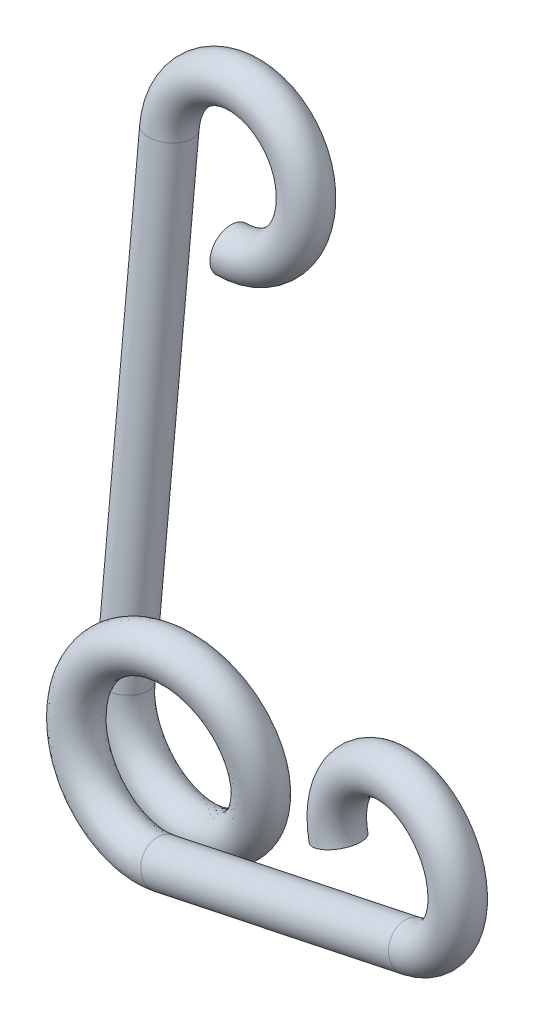
from build123d import *

# Parameters (mm, degrees)
SWEEP1_PITCH        = 1.779213779
SWEEP1_HEIGHT       = 2.304
SWEEP1_RADIUS       = 2.925
SWEEP1_START_ANGLE  = -180
SWEEP1_PROFILE_R    = 0.772
SKETCH7_R           = 0.772
BOSS_EXTRUDE1_DEPTH = 16.8
SKETCH8_R           = 0.772
BOSS_EXTRUDE2_DEPTH = 10.57
SKETCH11_R          = 0.772
SKETCH13_R          = 0.772


with BuildPart() as part:
    # Sweep1: sweep along a helix
    with BuildLine() as sweep1_path:
        add(Helix(SWEEP1_PITCH, SWEEP1_HEIGHT, SWEEP1_RADIUS, center=(0, 0, 0), direction=(0, 0, 1), mode=Mode.PRIVATE).rotate(Axis((0, 0, 0), (0, 0, 1)), SWEEP1_START_ANGLE))
    # Sweep1 profile (on start of the path) → Sweep1 (sweep)
    with BuildSketch(Plane(origin=(-2.925, 0, 0), x_dir=(0, -0.09635998191573415, -0.9953465496424848), z_dir=(3.723489167447742e-13, -0.9953465496424848, 0.09635998191573415))):
        Circle(SWEEP1_PROFILE_R)
    sweep(path=sweep1_path.line, is_frenet=True)

    # Sketch7 → Boss-Extrude1 (add)
    with BuildSketch(Plane(origin=(0, 0, 0), x_dir=(1, 0, 0), z_dir=(-6.585240748028275e-15, 0.9953465496424845, -0.0963599819157373))):
        with Locations(Location((-2.925, 0, 0), (0, 0, 90))):
            Circle(SKETCH7_R)
    extrude(amount=BOSS_EXTRUDE1_DEPTH)


with BuildPart() as boss_extrude2_tool:
    # Sketch8 → Boss-Extrude2 (new body)
    with BuildSketch(Plane(origin=(0.212247465, 0.061595199, 0.021395545), x_dir=(0.1075265661741758, -0.02528808688678901, -0.9938805512879286), z_dir=(0.9559074848202312, 0.2774087856392771, 0.09635998191573736))):
        with Locations(Location((-2.131457079, -3.045125851, 0), (0, 0, 3.11007264))):
            Circle(SKETCH8_R)
    extrude(amount=BOSS_EXTRUDE2_DEPTH)


with BuildPart() as part_1:
    add(part.part)


with BuildPart() as part_2:
    # Boss-Extrude2: joined with boss_extrude2_tool
    add(part_1.part.fuse(boss_extrude2_tool.part, tol=0.00001))

    # Sweep2: sweep along a path in Sketch10
    with BuildLine(Plane(origin=(0, 0, 0), x_dir=(1, 0, 0), z_dir=(1.146900370356108e-14, 0.0963599819157373, 0.9953465496424845))) as sweep2_path:
        ThreePointArc((-2.925, 16.8), (1.342766953, 18.567766953), (-0.425, 14.3))
    # Sketch11 → Sweep2 (sweep)
    with BuildSketch(Plane(origin=(0, 16.721822034, -1.618847696), x_dir=(1, 0, 0), z_dir=(-6.585240748028275e-15, 0.9953465496424845, -0.0963599819157373))):
        with Locations((-2.925, 0)):
            Circle(SKETCH11_R)
    sweep(path=sweep2_path.line)

    # Sweep3: sweep along a path in Sketch12
    with BuildLine(Plane(origin=(-0.229188261, 0.053900472, 2.118413736), x_dir=(-0.9942021192328977, -0.0023040594171736565, -0.10750273216536163), z_dir=(0.10752656617417579, -0.025288086886788894, -0.9938805512879287))) as sweep3_path:
        ThreePointArc((-11.213339644, 0.043386775), (-11.73796444, 4.632896943), (-8.121724926, 1.758588931))
    # Sketch13 → Sweep3 (sweep)
    with BuildSketch(Plane(origin=(10.316189579, 2.993806063, 1.039920554), x_dir=(0.10752656617417658, -0.02528808688679171, -0.9938805512879285), z_dir=(0.9559074848202312, 0.2774087856392772, 0.09635998191573736))):
        with Locations((-2.131457079, -3.045125851)):
            Circle(SKETCH13_R)
    sweep(path=sweep3_path.line)


solid = part_2.part
